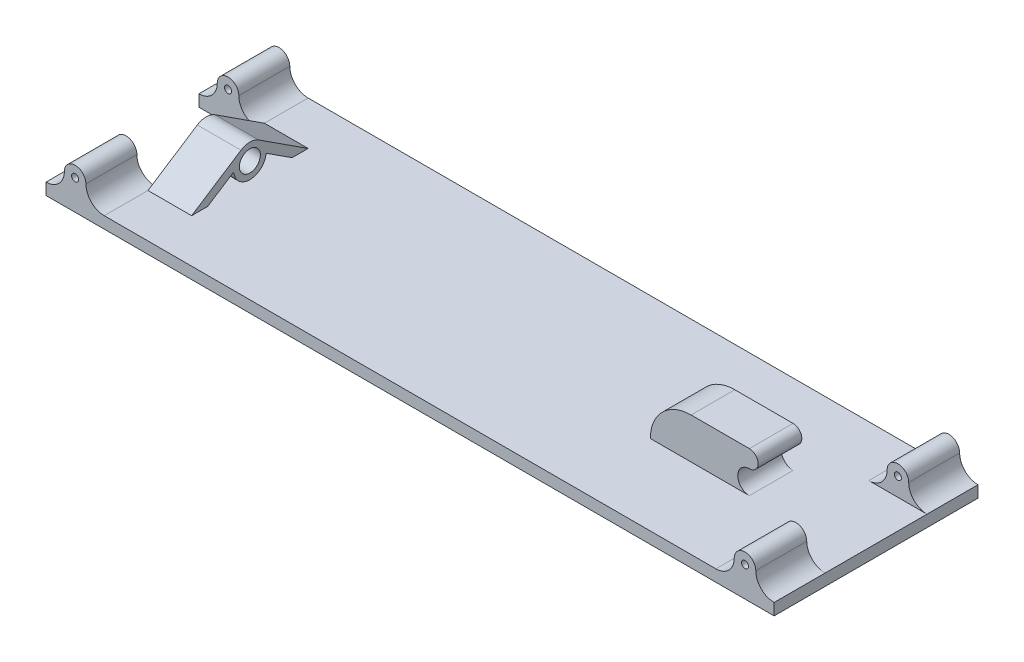
from build123d import *

# Parameters (mm, degrees)
SKETCH1_R           = 1.2
BOSS_EXTRUDE1_DEPTH = 35
SKETCH2_W           = 35
SKETCH2_H           = 10
CUT_EXTRUDE1_DEPTH  = 253.826027141
BOSS_EXTRUDE2_DEPTH = 7.5
SKETCH4_W           = 20
SKETCH4_H           = 35
CUT_EXTRUDE2_DEPTH  = 253.826027141
BOSS_EXTRUDE3_START = 20
SKETCH6_R           = 3.6
BOSS_EXTRUDE3_DEPTH = 15


with BuildPart() as part:
    # Sketch1 → Boss-Extrude1 (new, symmetric)
    with BuildSketch(Plane.XY):
        with BuildLine():
            Line((0, 0), (250, 0))
            Line((250, 0), (250, 4))
            ThreePointArc((250, 4), (245.545227279, 5.845227279), (243.7, 10.3))
            ThreePointArc((243.7, 10.3), (240, 14), (236.3, 10.3))
            ThreePointArc((236.3, 10.3), (234.454772721, 5.845227279), (230, 4))
            Line((230, 4), (20, 4))
            ThreePointArc((20, 4), (15.545227279, 5.845227279), (13.7, 10.3))
            ThreePointArc((13.7, 10.3), (10, 14), (6.3, 10.3))
            ThreePointArc((6.3, 10.3), (4.454772721, 5.845227279), (0, 4))
            Line((0, 4), (0, 0))
        make_face()
        with Locations((10, 10.3)):
            Circle(SKETCH1_R, mode=Mode.SUBTRACT)
        with Locations((240, 10.3)):
            Circle(SKETCH1_R, mode=Mode.SUBTRACT)
    extrude(amount=BOSS_EXTRUDE1_DEPTH, both=True)

    # Sketch2 → Cut-Extrude1 (cut, through all)
    with BuildSketch(Plane(origin=(0, 0, 0), x_dir=(0, 0, -1), z_dir=(1, 0, 0))):
        with Locations((0, 9)):
            Rectangle(SKETCH2_W, SKETCH2_H)
    extrude(amount=CUT_EXTRUDE1_DEPTH, mode=Mode.SUBTRACT)

    # Sketch3 → Boss-Extrude2 (add, symmetric)
    with BuildSketch(Plane.XY):
        with BuildLine():
            Line((214, 18), (194, 18))
            ThreePointArc((194, 18), (184.100505063, 13.899494937), (180, 4))
            Line((180, 4), (214, 4))
            ThreePointArc((214, 4), (210, 8), (214, 12))
            ThreePointArc((214, 12), (217, 15), (214, 18))
        make_face()
    extrude(amount=BOSS_EXTRUDE2_DEPTH, both=True)

    # Sketch4 → Cut-Extrude2 (cut, through all)
    with BuildSketch(Plane(origin=(0, 4, 0), x_dir=(1, 0, 0), z_dir=(0, 1, 0))):
        with Locations((10, 0)):
            Rectangle(SKETCH4_W, SKETCH4_H)
    extrude(amount=-CUT_EXTRUDE2_DEPTH, mode=Mode.SUBTRACT)

    # Sketch6 → Boss-Extrude3 (add)
    with BuildSketch(Plane(origin=(0, 0, 0), x_dir=(0, 0, -1), z_dir=(1, 0, 0)).offset(BOSS_EXTRUDE3_START)):
        with BuildLine():
            Line((-14.487917861, 4), (-5.57596765, 9.781748355))
            ThreePointArc((-5.57596765, 9.781748355), (0, 4.7), (5.57596765, 9.781748355))
            Line((5.57596765, 9.781748355), (14.487917861, 4))
            Line((14.487917861, 4), (20, 4))
            Line((20, 4), (3.047850082, 14.997936768))
            ThreePointArc((3.047850082, 14.997936768), (0, 15.9), (-3.047850082, 14.997936768))
            Line((-3.047850082, 14.997936768), (-20, 4))
            Line((-20, 4), (-14.487917861, 4))
        make_face()
        with Locations((0, 10.3)):
            Circle(SKETCH6_R, mode=Mode.SUBTRACT)
    extrude(amount=BOSS_EXTRUDE3_DEPTH)


solid = part.part
